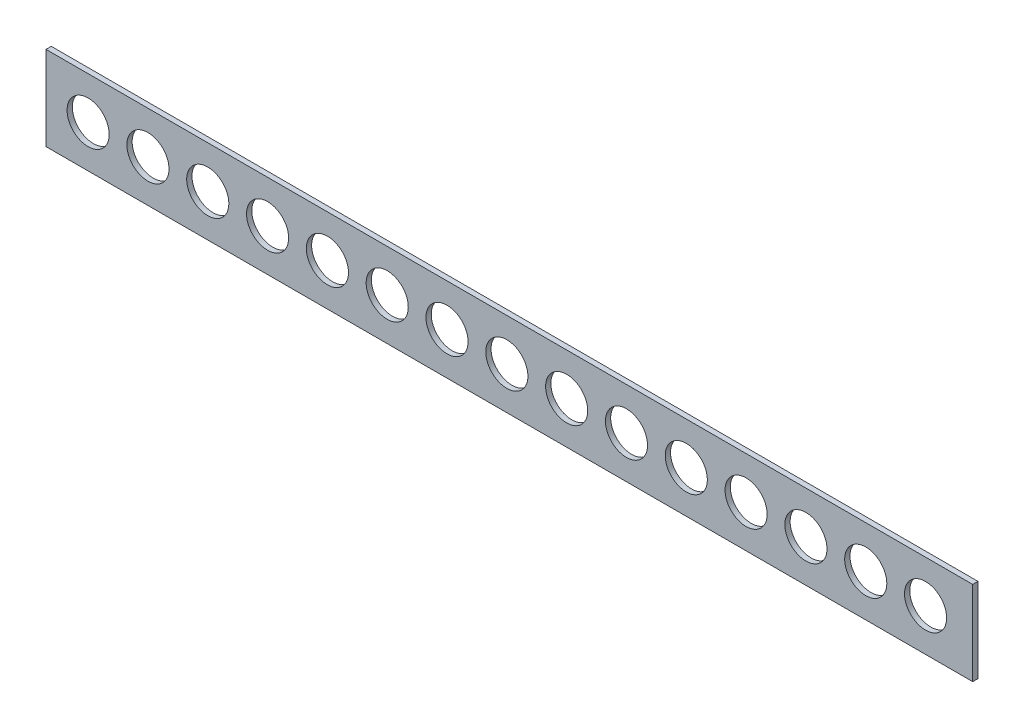
from build123d import *

# Parameters (mm, degrees)
SKETCH1_W           = 558.8
SKETCH1_H           = 50.8
BOSS_EXTRUDE1_DEPTH = 3.175
SKETCH2_R           = 12.7
CUT_EXTRUDE1_DEPTH  = 562.113322445
LPATTERN1_COUNT     = 15
LPATTERN1_PITCH     = 36.068


with BuildPart() as part:
    # Sketch1 → Boss-Extrude1 (new body)
    with BuildSketch(Plane.XY):
        with Locations((279.4, 25.4)):
            Rectangle(SKETCH1_W, SKETCH1_H)
    extrude(amount=BOSS_EXTRUDE1_DEPTH)

    # Sketch2 → Cut-Extrude1 (cut, through all)
    with BuildSketch(Plane.XY.offset(3.175)):
        with Locations((25.4, 25.4)):
            Circle(SKETCH2_R)
    cut_extrude1 = extrude(amount=-CUT_EXTRUDE1_DEPTH, mode=Mode.SUBTRACT)

    # LPattern1: Cut-Extrude1 ×15
    with Locations(*[(i * LPATTERN1_PITCH, 0, 0) for i in range(1, LPATTERN1_COUNT)]):
        add(cut_extrude1, mode=Mode.SUBTRACT)


solid = part.part
